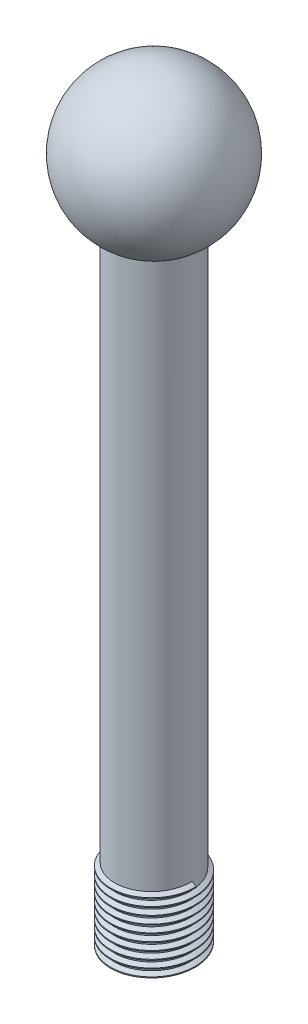
from build123d import *

# Parameters (mm, degrees)
THREAD1_PITCH = 1
THREAD1_FROM  = 1


with BuildPart() as part:
    # Sketch1 → Revolve1 (revolve)
    with BuildSketch(Plane.XY):
        with BuildLine():
            Line((0, -50), (5, -50))
            Line((5, -50), (5, 31.339745962))
            ThreePointArc((5, 31.339745962), (9.659258263, 42.588190451), (0, 50))
            Line((0, 50), (0, -50))
        make_face()
    revolve(axis=Axis((0, -50, 0), (0, 1, 0)))

    # Thread1: arcs per turn and ends read off the stored shape
    # Thread1: the profile of Thread Profile1 profile screwed along a right-hand helix through 10 turns, 8 arcs to a turn; built about Z, then put on its axis
    thread1_z = Axis((0, 0, 0), (0, 0, 1))
    thread1_corners = [(4.9997, 0, -0.000173205), (5.541265875, 0, 0.312499999), (5.541265875, 0, 0.437499999), (4.9997, 0, 0.750173202)]
    with BuildLine(mode=Mode.PRIVATE) as thread1_profile:
        Line(thread1_corners[0], thread1_corners[1])
        Line(thread1_corners[1], thread1_corners[2])
        Line(thread1_corners[2], thread1_corners[3])
        Line(thread1_corners[3], thread1_corners[0])
    thread1_cap = Face(thread1_profile.wire())
    thread1_turn_angles = [0, 22.5, 45, 67.5, 90, 112.5, 135, 157.5, 180, 202.5, 225, 247.5, 270, 292.5, 315, 337.5, 360]
    thread1_turn_weights = [1, 0.9238795325112867, 1, 0.9238795325112867, 1, 0.9238795325112867, 1, 0.9238795325112867, 1, 0.9238795325112867, 1, 0.9238795325112867, 1, 0.9238795325112867, 1, 0.9238795325112867, 1]
    thread1_turn_rails = [Edge.make_bspline([Vector(p[0], p[1], 0).rotate(thread1_z, thread1_turn_angles[k]) / thread1_turn_weights[k] + Vector(0, 0, p[2] + THREAD1_PITCH * thread1_turn_angles[k] / 360) for k in range(17)], [0, 0, 0, 1, 1, 2, 2, 3, 3, 4, 4, 5, 5, 6, 6, 7, 7, 8, 8, 8], 2, thread1_turn_weights) for p in thread1_corners]
    thread1_turn_sides = [Face.make_surface_from_curves(thread1_turn_rails[p[0]], thread1_turn_rails[p[1]]) for p in [(0, 1), (1, 2), (2, 3), (3, 0)]]
    thread1 = Plane(origin=(0, -51, 0), x_dir=(1, 0, 0), z_dir=(0, 1, 0)) * split(Solid(Shell([*[p.moved(Location((0, 0, THREAD1_PITCH * i))) for i in range(10) for p in thread1_turn_sides], thread1_cap, thread1_cap.rotate(thread1_z, 3600).moved(Location((0, 0, THREAD1_PITCH * 3600 / 360)))])), bisect_by=Plane.XY.offset(THREAD1_FROM), keep=Keep.TOP, mode=Mode.PRIVATE)
    add(thread1)


solid = part.part
